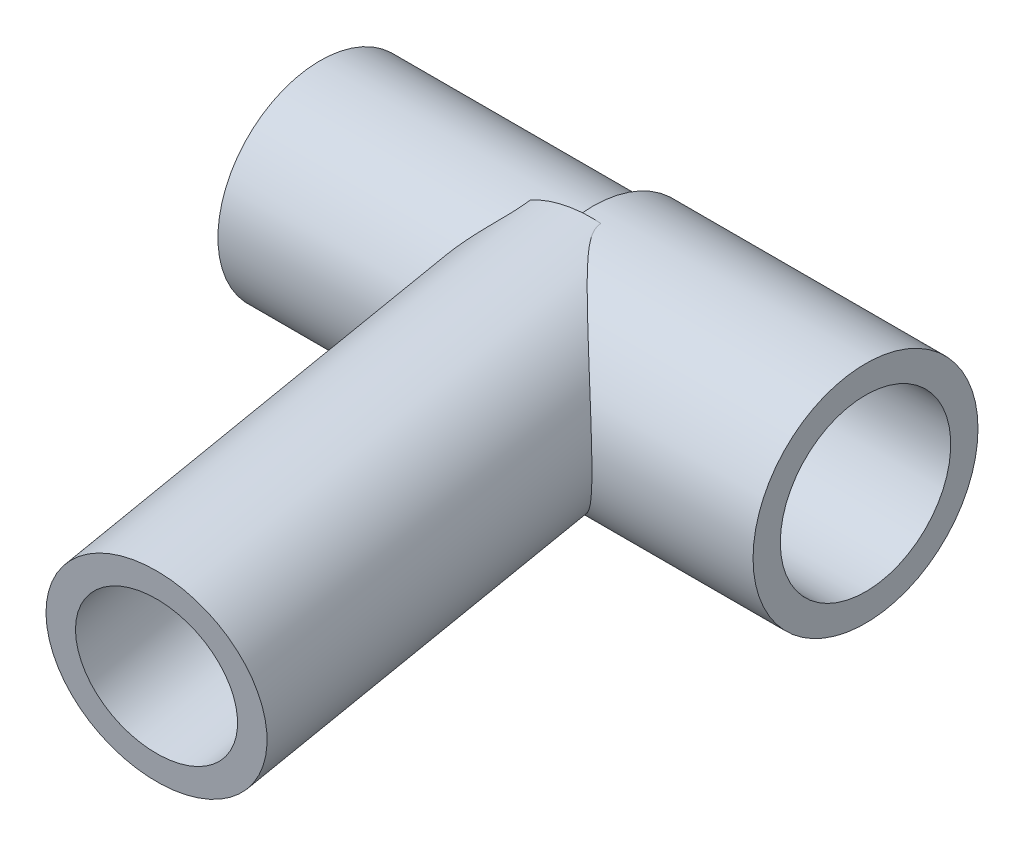
from build123d import *

# Parameters (mm, degrees)
SKETCH5_W = 40
SKETCH5_H = 4
SKETCH6_W = 40
SKETCH6_H = 4


with BuildPart() as part:
    # Sketch5 → Revolve2 (revolve)
    with BuildSketch(Plane(origin=(0, 0, 0), x_dir=(1, 0, 0), z_dir=(0, 1, 0))):
        with Locations((20, 2)):
            Rectangle(SKETCH5_W, SKETCH5_H)
    revolve(axis=Axis((0, 0, -16.5), (1, 0, 0)))

    # Sketch6 → Revolve4 (revolve)
    with BuildSketch(Plane(origin=(0, 0, 0), x_dir=(1, 0, 0), z_dir=(0, 1, 0))):
        with Locations((-20, 3.5)):
            Rectangle(SKETCH6_W, SKETCH6_H)
    revolve(axis=Axis((0, 0, -16.5), (-1, 0, 0)))

    # Sketch8 → Revolve5 (revolve)
    with BuildSketch(Plane(origin=(0, 0, 0), x_dir=(1, 0, 0), z_dir=(0, 0.9943889131791124, 0.10578605459352264))):
        Polygon((14.952481736, 17.600434227), (10.965153273, 17.282296318), (16.532566685, -52.495951782), (20.519895148, -52.177813873), align=None)
    revolve(axis=Axis((0, 1.735675918, -16.315353626), (0.07953447731756534, -0.10545093661344335, 0.991238804166367)))


solid = part.part
